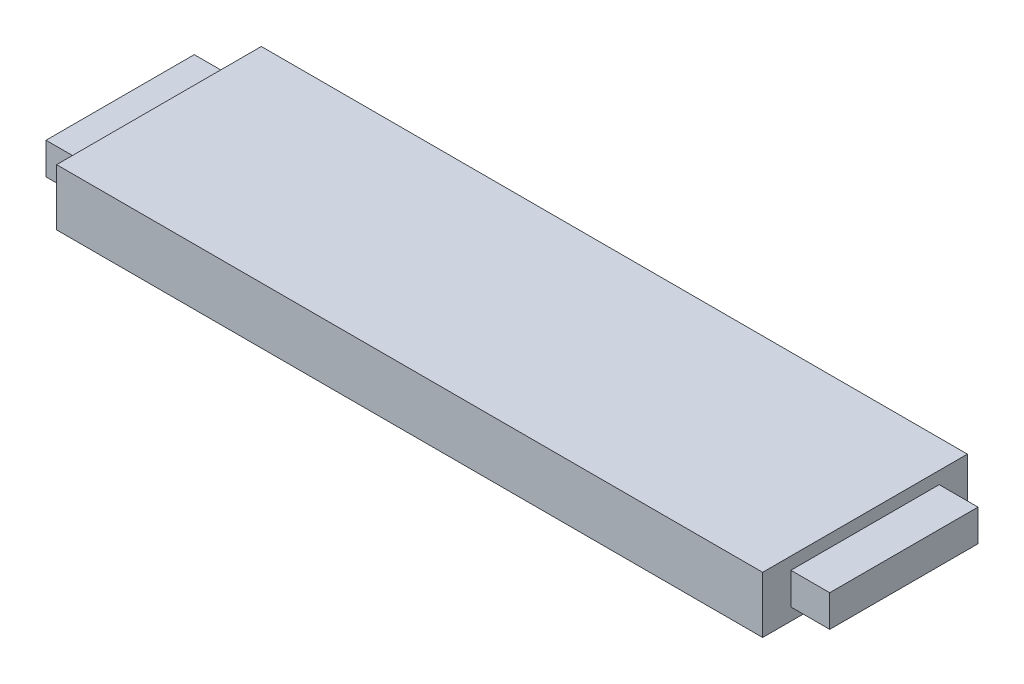
from build123d import *

# Parameters (mm, degrees)
SKETCH_1_W      = 99.99997774
SKETCH_1_H      = 28.996988848
EXTRUDE_1_DEPTH = 8
SKETCH_2_W      = 21.001828318
SKETCH_2_H      = 4.50112507
EXTRUDE_2_DEPTH = 5.5
SKETCH_3_W      = 20.998493162
SKETCH_3_H      = 4.496055774
EXTRUDE_3_DEPTH = 5.5


with BuildPart() as part:
    # Эскиз1 → Бобышка-Вытянуть1 (new body)
    with BuildSketch(Plane(origin=(0, 0, 0), x_dir=(1, 0, 0), z_dir=(0, 1, 0))):
        Rectangle(SKETCH_1_W, SKETCH_1_H)
    extrude(amount=EXTRUDE_1_DEPTH)

    # Эскиз2 → Бобышка-Вытянуть2 (add)
    with BuildSketch(Plane(origin=(49.99998887, 0, 0), x_dir=(0, 0, -1), z_dir=(1, 0, 0))):
        with Locations((0, 4)):
            Rectangle(SKETCH_2_W, SKETCH_2_H)
    extrude(amount=EXTRUDE_2_DEPTH)

    # Эскиз3 → Бобышка-Вытянуть3 (add)
    with BuildSketch(Plane.ZY.offset(49.99998887)):
        with Locations((0, 4)):
            Rectangle(SKETCH_3_W, SKETCH_3_H)
    extrude(amount=EXTRUDE_3_DEPTH)


solid = part.part
